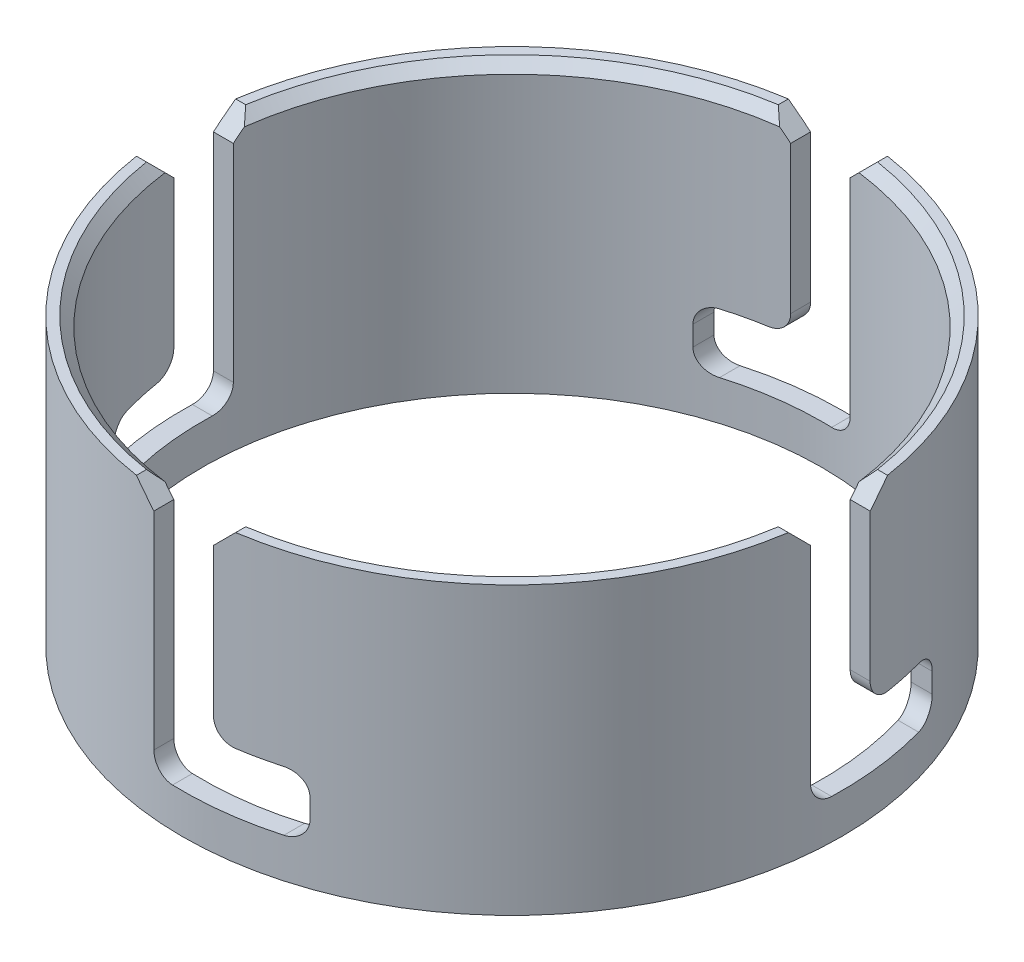
from build123d import *

# Parameters (mm, degrees)
SKETCH2_W                    = 5
SKETCH2_H                    = 72.15
CUT_EXTRUDE1_DEPTH           = 138.901459688
FILLET1_R                    = 5
CHAMFER1_SIZE                = 5
FILLET3_R                    = 5
CIRPATTERN1_COUNT            = 4
FILLET1_OF_CIRPATTERN1_R     = 5
CHAMFER1_OF_CIRPATTERN1_SIZE = 5
FILLET3_OF_CIRPATTERN1_R     = 5
CHAMFER2_SIZE                = 2.5


with BuildPart() as part:
    # Sketch2 → Revolve1 (revolve)
    with BuildSketch(Plane(origin=(0, 0, 0), x_dir=(0, 0, -1), z_dir=(1, 0, 0))):
        with Locations((-80.59991, 36.075)):
            Rectangle(SKETCH2_W, SKETCH2_H)
    revolve(axis=Axis((0, -3.6075, 0), (0, 1, 0)))

    # Sketch3 → Cut-Extrude1 (cut, through all)
    with BuildSketch(Plane(origin=(0, 0, 0), x_dir=(0, 0, -1), z_dir=(1, 0, 0))):
        Polygon((-7.5, 72.15), (7.5, 72.15), (7.5, 10), (-27.5, 10), (-27.5, 25), (-7.5, 25), align=None)
    cut_extrude1 = extrude(amount=-CUT_EXTRUDE1_DEPTH, mode=Mode.SUBTRACT)

    # Fillet1
    fillet1_edges = [part.edges().sort_by_distance(p)[0] for p in [
        (-80.249865102, 25, 7.5),
        (-80.249865102, 10, -7.5),
    ]]
    fillet(fillet1_edges, radius=FILLET1_R)

    # Chamfer1
    chamfer1_edges = [part.edges().sort_by_distance(p)[0] for p in [
        (-80.249865102, 72.15, 7.5),
        (-80.249865102, 72.15, -7.5),
    ]]
    chamfer(chamfer1_edges, length=CHAMFER1_SIZE)

    # Fillet3
    fillet3_edges = [part.edges().sort_by_distance(p)[0] for p in [
        (-75.757976786, 25, 27.5),
        (-75.757976786, 10, 27.5),
    ]]
    fillet(fillet3_edges, radius=FILLET3_R)

    # CirPattern1: Cut-Extrude1 ×4 about axis
    cirpattern1_axis = Axis((0, -3.6075, 0), (0, 1, 0))
    for i in range(1, CIRPATTERN1_COUNT):
        add(cut_extrude1.rotate(cirpattern1_axis, i * 360 / CIRPATTERN1_COUNT), mode=Mode.SUBTRACT)

    # Fillet1 of CirPattern1
    fillet1_of_cirpattern1_edges = [part.edges().sort_by_distance(p)[0] for p in [
        (7.5, 25, 80.249865102),
        (-7.5, 10, 80.249865102),
        (80.249865102, 25, -7.5),
        (80.249865102, 10, 7.5),
        (-7.5, 25, -80.249865102),
        (7.5, 10, -80.249865102),
    ]]
    fillet(fillet1_of_cirpattern1_edges, radius=FILLET1_OF_CIRPATTERN1_R)

    # Chamfer1 of CirPattern1
    chamfer1_of_cirpattern1_edges = [part.edges().sort_by_distance(p)[0] for p in [
        (7.5, 72.15, 80.249865102),
        (-7.5, 72.15, 80.249865102),
        (80.249865102, 72.15, -7.5),
        (80.249865102, 72.15, 7.5),
        (-7.5, 72.15, -80.249865102),
        (7.5, 72.15, -80.249865102),
    ]]
    chamfer(chamfer1_of_cirpattern1_edges, length=CHAMFER1_OF_CIRPATTERN1_SIZE)

    # Fillet3 of CirPattern1
    fillet3_of_cirpattern1_edges = [part.edges().sort_by_distance(p)[0] for p in [
        (27.5, 25, 75.757976786),
        (27.5, 10, 75.757976786),
        (75.757976786, 25, -27.5),
        (75.757976786, 10, -27.5),
        (-27.5, 25, -75.757976786),
        (-27.5, 10, -75.757976786),
    ]]
    fillet(fillet3_of_cirpattern1_edges, radius=FILLET3_OF_CIRPATTERN1_R)

    # Chamfer2
    chamfer2_edges = [part.edges().sort_by_distance(p)[0] for p in [
        (-55.224975971, 72.15, -55.224975971),
        (55.224975971, 72.15, -55.224975971),
        (55.224975971, 72.15, 55.224975971),
        (-55.224975971, 72.15, 55.224975971),
    ]]
    chamfer(chamfer2_edges, length=CHAMFER2_SIZE)


solid = part.part
